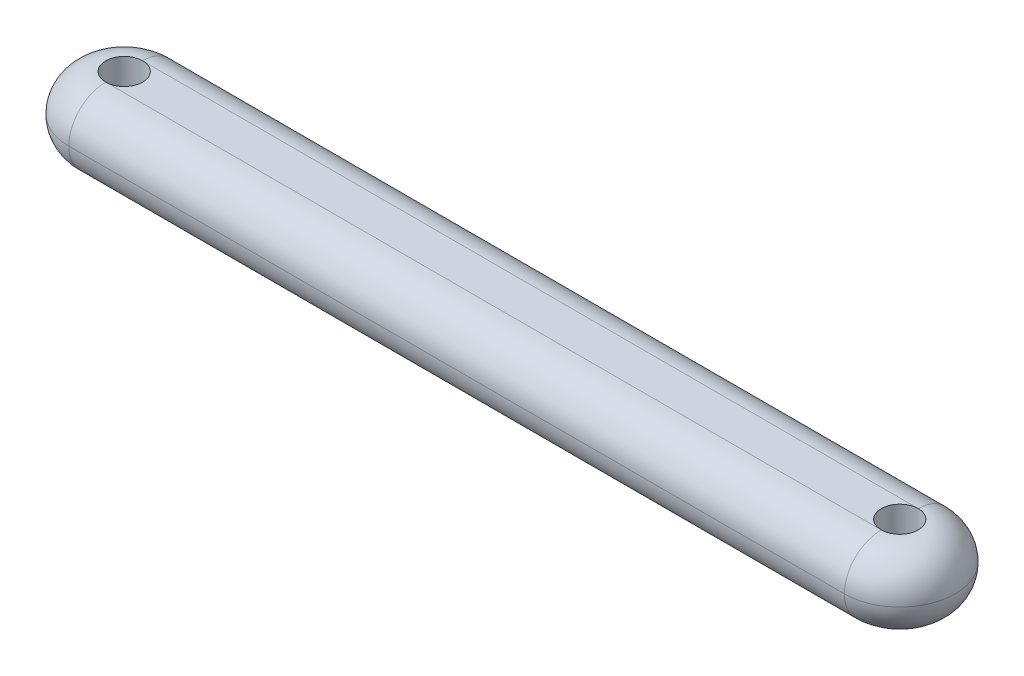
from build123d import *

# Parameters (mm, degrees)
CROQUIS1_R              = 2.5
SALIENTE_EXTRUIR1_DEPTH = 5
REDONDEO1_R             = 5


with BuildPart() as part:
    # Croquis1 → Saliente-Extruir1 (new, symmetric)
    with BuildSketch(Plane(origin=(0, 0, 0), x_dir=(-1, 0, 0), z_dir=(0, 1, 0))):
        with BuildLine():
            Line((0, 7.5), (105, 7.5))
            ThreePointArc((105, 7.5), (112.5, 0), (105, -7.5))
            Line((105, -7.5), (0, -7.5))
            ThreePointArc((0, -7.5), (-7.5, 0), (0, 7.5))
        make_face()
        with Locations(Location((0, 0, 0), (0, 0, 90))):
            Circle(CROQUIS1_R, mode=Mode.SUBTRACT)
        with Locations(Location((105, 0, 0), (0, 0, 90))):
            Circle(CROQUIS1_R, mode=Mode.SUBTRACT)
    extrude(amount=SALIENTE_EXTRUIR1_DEPTH, both=True)

    # Redondeo1
    redondeo1_edges = [part.edges().sort_by_distance(p)[0] for p in [
        (7.5, 5, 0),
        (-52.5, 5, 7.5),
        (-112.5, 5, 0),
        (7.5, -5, 0),
        (-52.5, -5, 7.5),
        (-112.5, -5, 0),
        (-52.5, 5, -7.5),
        (-52.5, -5, -7.5),
    ]]
    fillet(redondeo1_edges, radius=REDONDEO1_R - 0.0001)  # a hair under: the kernel refuses the full size


solid = part.part
